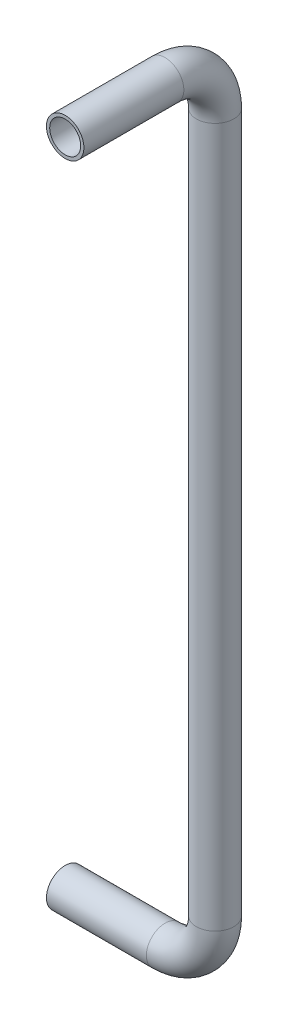
from build123d import *

# Parameters (mm, degrees)
SKETCH1_R            = 9.525
SKETCH1_R_2          = 7.874
SWEEP2_START         = 25.3999999
SWEEP2_OUTLINE_R     = 9.525
SWEEP2_OUTLINE_R_2   = 7.874
SWEEP2_DEPTH         = 50.8000001
SWEEP2_2_OUTLINE_R   = 9.525
SWEEP2_2_OUTLINE_R_2 = 7.874
SWEEP2_2_ANGLE       = 90


with BuildPart() as part:
    # Sweep1: sweep along a path in Sketch2
    with BuildLine(Plane.XY) as sweep1_path:
        Line((76.2, 381), (76.2, 25.4))
        ThreePointArc((76.2, 25.4), (68.760512242, 7.439487758), (50.8, 0))
        Line((50.8, 0), (0, 0))
    # Sketch1 → Sweep1 (sweep)
    with BuildSketch(Plane(origin=(0, 0, 0), x_dir=(0, -1, 0), z_dir=(1, 0, 0))):
        Circle(SKETCH1_R)
        Circle(SKETCH1_R_2, mode=Mode.SUBTRACT)
    sweep(path=sweep1_path.line)



with BuildPart() as body_2:
    # Sweep2: read off the stored shape, not the designer's step
    # Sweep2 outline → Sweep2 (new body)
    with BuildSketch(Plane.XY.offset(SWEEP2_START)):
        with Locations((76.2, 406.4)):
            Circle(SWEEP2_OUTLINE_R)
        with Locations((76.2, 406.4)):
            Circle(SWEEP2_OUTLINE_R_2, mode=Mode.SUBTRACT)
    extrude(amount=SWEEP2_DEPTH)


with BuildPart() as part_1:
    add(part.part)

    add(body_2.part)  # Sweep2 2 merges body 2
    # Sweep2 2 outline → Sweep2 2 (revolve)
    with BuildSketch(Plane(origin=(0, 381, 25.4), x_dir=(0, 0, -1), z_dir=(0, -1, 0))):
        with Locations((25.4, 76.2)):
            Circle(SWEEP2_2_OUTLINE_R)
        with Locations((25.4, 76.2)):
            Circle(SWEEP2_2_OUTLINE_R_2, mode=Mode.SUBTRACT)
    revolve(axis=Axis((0, 381, 25.4), (1, 0, 0)), revolution_arc=SWEEP2_2_ANGLE)


solid = part_1.part
